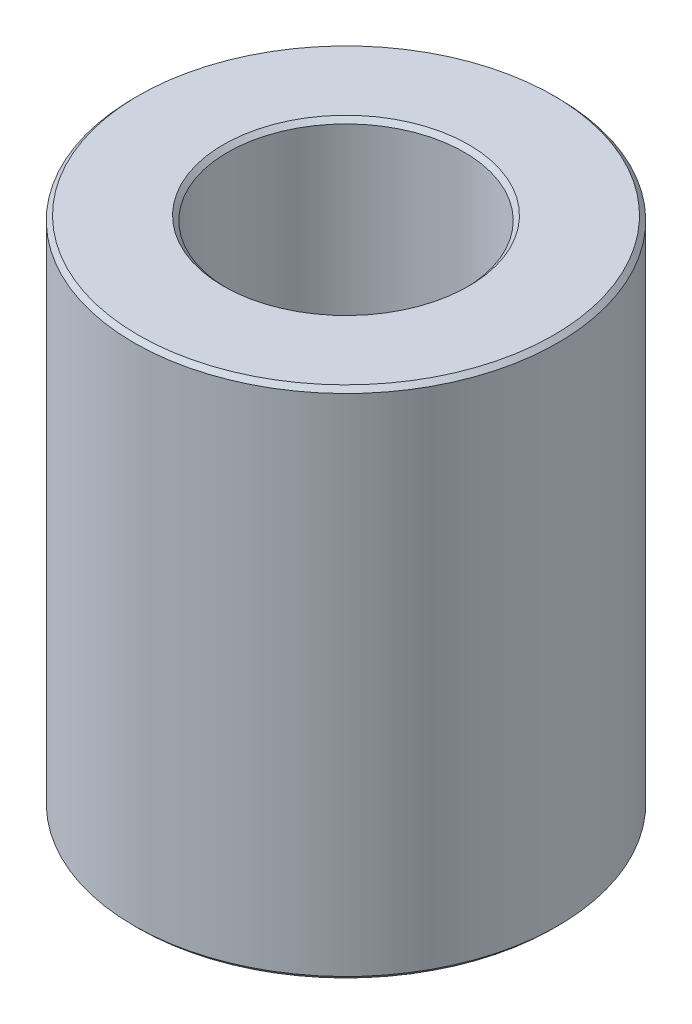
from build123d import *

# Parameters (mm, degrees)
SKETCH1_R           = 40
BOSS_EXTRUDE1_DEPTH = 96.942581672
SKETCH2_R           = 22.321175834
CUT_EXTRUDE1_DEPTH  = 113.240207329
CHAMFER1_SIZE       = 0.829464198


with BuildPart() as part:
    # Sketch1 → Boss-Extrude1 (new body)
    with BuildSketch(Plane(origin=(0, 0, 0), x_dir=(1, 0, 0), z_dir=(0, 1, 0))):
        Circle(SKETCH1_R)
    extrude(amount=BOSS_EXTRUDE1_DEPTH)

    # Sketch2 → Cut-Extrude1 (cut, through all)
    with BuildSketch(Plane(origin=(0, 0, 0), x_dir=(1, 0, 0), z_dir=(0, 1, 0))):
        Circle(SKETCH2_R)
    extrude(amount=CUT_EXTRUDE1_DEPTH, mode=Mode.SUBTRACT)

    # Chamfer1
    chamfer1_edges = [part.edges().sort_by_distance(p)[0] for p in [
        (-22.321175834, 96.942581672, 0),
        (-22.321175834, 0, 0),
        (-40, 0, 0),
        (-40, 96.942581672, 0),
    ]]
    chamfer(chamfer1_edges, length=CHAMFER1_SIZE)


solid = part.part
